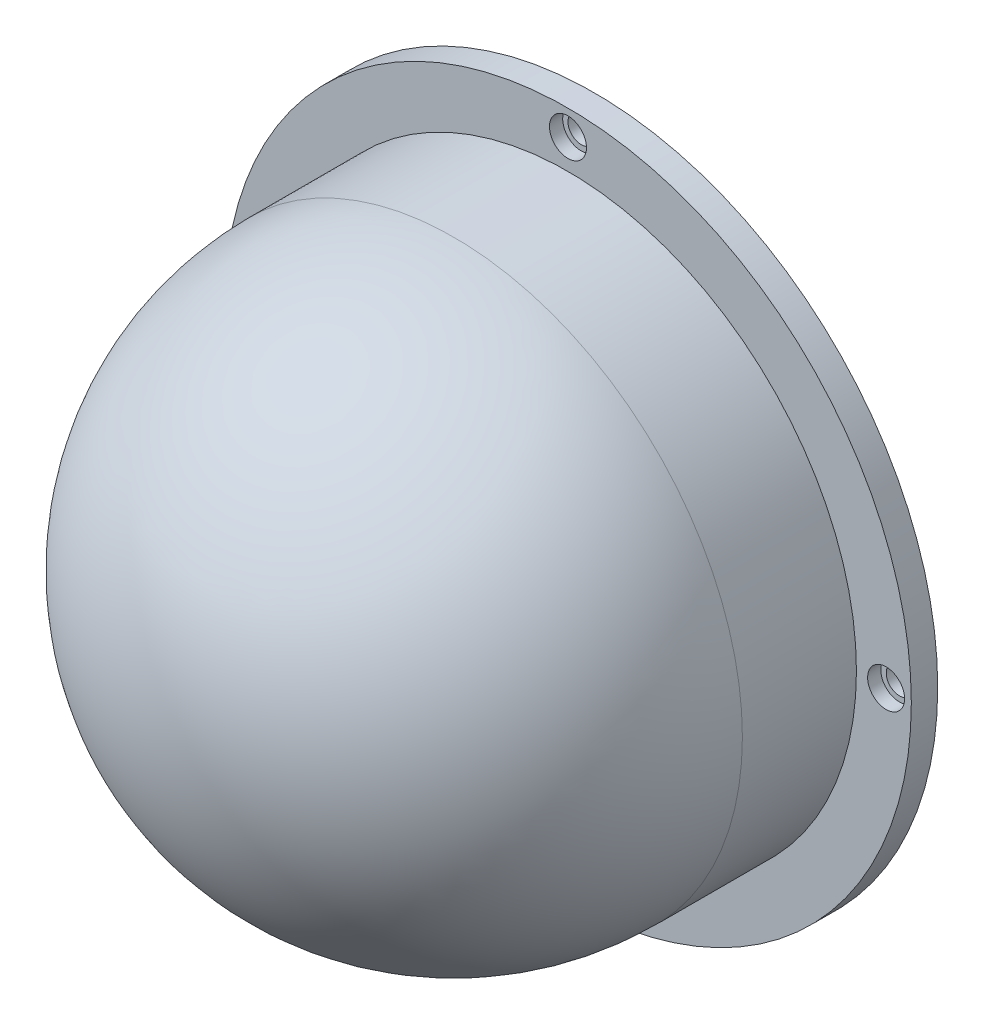
from build123d import *

# Parameters (mm, degrees)
SKETCH2_R           = 65
BOSS_EXTRUDE1_DEPTH = 5
SKETCH3_R           = 54.61
BOSS_EXTRUDE2_DEPTH = 76.2
FILLET8_R           = 54.61
SKETCH7_R           = 2.5
CUT_EXTRUDE2_DEPTH  = 5
SKETCH8_R           = 3.5
CUT_EXTRUDE3_DEPTH  = 2.5
CIRPATTERN1_COUNT   = 4


# Read off the part's stored shape, not the designer's step: Shell1
with BuildPart() as part:
    # Sketch2 → Boss-Extrude1 (new body)
    with BuildSketch(Plane(origin=(0, 0, 0), x_dir=(0, 1, 0), z_dir=(0, 0, 1))):
        with Locations(Location((0, 0, 0), (0, 0, 270))):
            Circle(SKETCH2_R)
    extrude(amount=BOSS_EXTRUDE1_DEPTH)

    # Sketch3 → Boss-Extrude2 (add)
    with BuildSketch(Plane.XY.offset(5)):
        with Locations(Location((0, 0, 0), (0, 0, 180))):
            Circle(SKETCH3_R)
    extrude(amount=BOSS_EXTRUDE2_DEPTH)

    # Fillet8
    fillet8_edges = [part.edges().sort_by_distance(p)[0] for p in [
        (54.61, 0, 81.2),
    ]]
    fillet(fillet8_edges, radius=FILLET8_R)

    # Shell1 outline → Shell1 (revolve, cut)
    with BuildSketch(Plane.XZ):
        with BuildLine():
            Line((49.61, 0), (49.61, 26.58999995))
            ThreePointArc((49.61, 26.58999995), (35.079567432, 61.669567397), (0, 76.2))
            Line((0, 76.2), (0, 0))
            Line((0, 0), (49.61, 0))
        make_face()
    revolve(axis=Axis((0, 0, 0), (0, 0, 1)), mode=Mode.SUBTRACT)

    # Sketch7 → Cut-Extrude2 (cut)
    with BuildSketch(Plane.XY.offset(5)):
        with Locations((0, 60.247846794)):
            Circle(SKETCH7_R)
    cut_extrude2 = extrude(amount=-CUT_EXTRUDE2_DEPTH, mode=Mode.SUBTRACT)

    # Sketch8 → Cut-Extrude3 (cut)
    with BuildSketch(Plane.XY.offset(5)):
        with Locations((0, 60.223600104)):
            Circle(SKETCH8_R)
    cut_extrude3 = extrude(amount=-CUT_EXTRUDE3_DEPTH, mode=Mode.SUBTRACT)

    # CirPattern1: Cut-Extrude2, Cut-Extrude3 ×4 about axis
    cirpattern1_axis = Axis((0, 0, 0), (0, 0, 1))
    add([cut_extrude2.rotate(cirpattern1_axis, i * 360 / CIRPATTERN1_COUNT) for i in range(1, CIRPATTERN1_COUNT)], mode=Mode.SUBTRACT)
    add([cut_extrude3.rotate(cirpattern1_axis, i * 360 / CIRPATTERN1_COUNT) for i in range(1, CIRPATTERN1_COUNT)], mode=Mode.SUBTRACT)


solid = part.part
